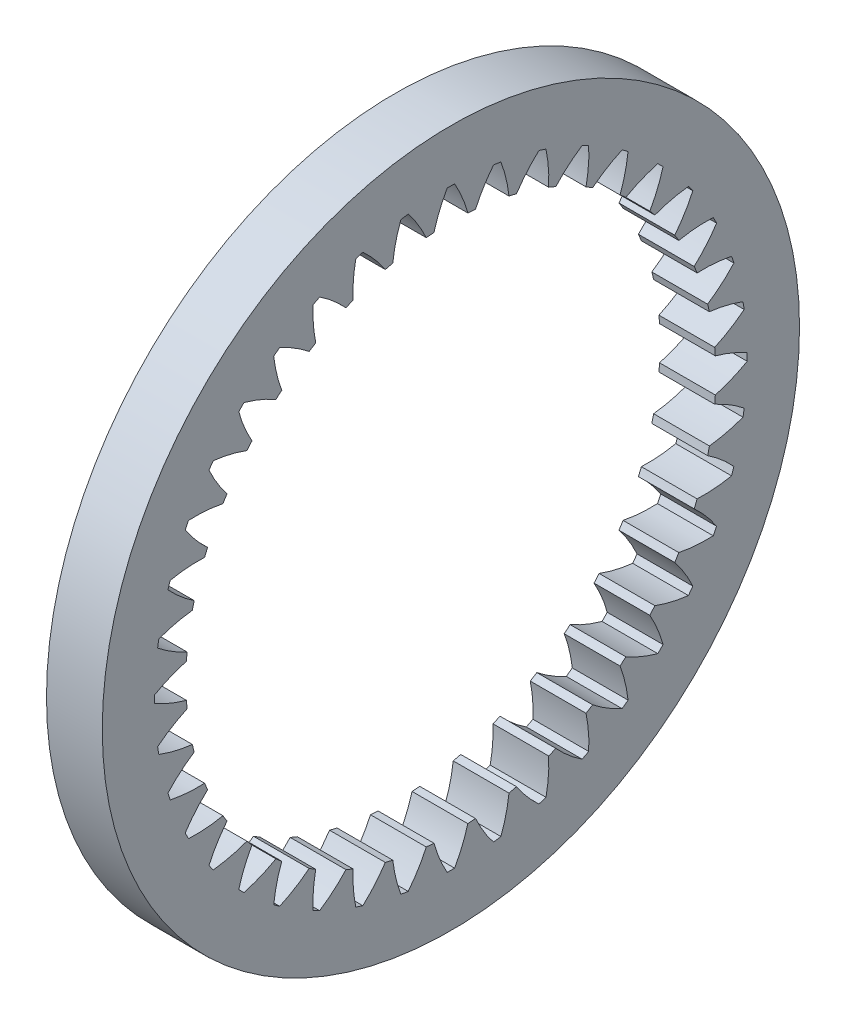
from build123d import *

# Parameters (mm, degrees)
BASPROSKE_W     = 6
BASPROSKE_H     = 9
TOOTHCUT_DEPTH  = 54.371340624
TEETHCUTS_COUNT = 40
TEETHCUTS_ANGLE = 351


with BuildPart() as part:
    # BasProSke → Base-Revolve (revolve)
    with BuildSketch(Plane(origin=(0, 0, 0), x_dir=(1, 0, 0), z_dir=(0, 1, 0))):
        with Locations((3, 33)):
            Rectangle(BASPROSKE_W, BASPROSKE_H)
    revolve(axis=Axis((-10, 0, 0), (1, 0, 0)))

    # TooCutSke → ToothCut (cut, through all)
    with BuildSketch(Plane(origin=(0, 0, 0), x_dir=(0, 0, -1), z_dir=(1, 0, 0))):
        with BuildLine():
            ThreePointArc((1.829037691, 28.41579607), (1.222083787, 30.189429646), (0.39864463, 31.873507157))
            ThreePointArc((0.39864463, 31.873507157), (0, 31.876), (-0.39864463, 31.873507157))
            ThreePointArc((-0.39864463, 31.873507157), (-1.222083787, 30.189429646), (-1.829037691, 28.41579607))
            ThreePointArc((-1.829037691, 28.41579607), (0, 28.4746), (1.829037691, 28.41579607))
        make_face()
    toothcut = extrude(amount=TOOTHCUT_DEPTH, mode=Mode.SUBTRACT)

    # TeethCuts: ToothCut ×40 about axis
    teethcuts_axis = Axis((-10, 0, 0), (1, 0, 0))
    for i in range(1, TEETHCUTS_COUNT):
        add(toothcut.rotate(teethcuts_axis, i * TEETHCUTS_ANGLE / (TEETHCUTS_COUNT - 1)), mode=Mode.SUBTRACT)


solid = part.part
